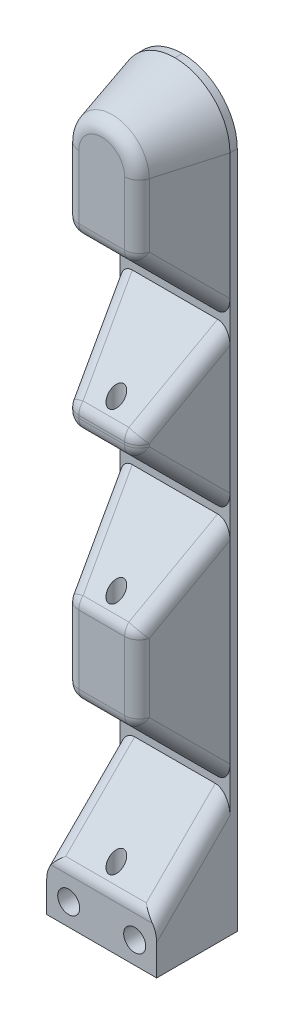
from build123d import *

# Parameters (mm, degrees)
SKETCH1_W                     = 15
SKETCH1_H                     = 100
BOSS_EXTRUDE1_DEPTH           = 1
FILLET1_R                     = 7.5
BOSS_EXTRUDE2_DEPTH           = 10
BOSS_EXTRUDE2_DRAFT           = 16
SKETCH3_W                     = 15
SKETCH3_H                     = 22
BOSS_EXTRUDE2_PROFILE_2_DEPTH = 10
BOSS_EXTRUDE2_PROFILE_2_DRAFT = 16
SKETCH3_H_2                   = 31
BOSS_EXTRUDE2_PROFILE_3_DEPTH = 10
BOSS_EXTRUDE2_PROFILE_3_DRAFT = 16
SKETCH3_3_W                   = 15
SKETCH3_3_H                   = 17
BOSS_EXTRUDE3_DEPTH           = 10
CUT_EXTRUDE1_DEPTH            = 102.71528892
SKETCH5_R                     = 1
CUT_EXTRUDE2_DEPTH            = 95
FILLET2_R                     = 2
SKETCH6_R                     = 1.5
CUT_EXTRUDE3_DEPTH            = 102.71528892


with BuildPart() as part:
    # Sketch1 → Boss-Extrude1 (new body)
    with BuildSketch(Plane.XY):
        with Locations((-7.5, 50)):
            Rectangle(SKETCH1_W, SKETCH1_H)
    extrude(amount=BOSS_EXTRUDE1_DEPTH)

    # Fillet1
    fillet1_edges = [part.edges().sort_by_distance(p)[0] for p in [
        (0, 100, 0.5),
        (-15, 100, 0.5),
    ]]
    fillet(fillet1_edges, radius=FILLET1_R - 0.0001)  # a hair under: the kernel refuses the full size


with BuildPart() as boss_extrude2_tool:
    # Sketch3 → Boss-Extrude2 (with draft: the straight prism first)
    with BuildSketch(Plane.XY.offset(1)):
        with BuildLine():
            ThreePointArc((-7.5, 100), (-12.803300859, 97.803300859), (-15, 92.5))
            Line((-15, 92.5), (-15, 73))
            Line((-15, 73), (0, 73))
            Line((0, 73), (0, 92.5))
            ThreePointArc((0, 92.5), (-2.196699141, 97.803300859), (-7.5, 100))
        make_face()
    extrude(amount=BOSS_EXTRUDE2_DEPTH)
    # Boss-Extrude2: the draft: its side faces are tilted about the plane it starts from
    boss_extrude2_sides = [boss_extrude2_tool.faces().sort_by_distance(p)[0] for p in [
        (-7.5, 100, 6),
        (-7.5, 73, 6),
        (0, 82.75, 6),
        (-15, 82.75, 6),
    ]]
    draft(boss_extrude2_sides, Plane.XY.offset(1), BOSS_EXTRUDE2_DRAFT)


with BuildPart() as part_1:
    add(part.part)

    # Boss-Extrude2: add boss_extrude2_tool
    add(boss_extrude2_tool.part)


with BuildPart() as boss_extrude2_profile_2_tool:
    # Sketch3 → Boss-Extrude2 profile 2 (with draft: the straight prism first)
    with BuildSketch(Plane.XY.offset(1)):
        with Locations((-7.5, 61)):
            Rectangle(SKETCH3_W, SKETCH3_H)
    extrude(amount=BOSS_EXTRUDE2_PROFILE_2_DEPTH)
    # Boss-Extrude2 profile 2: the draft: its side faces are tilted about the plane it starts from
    boss_extrude2_profile_2_sides = [boss_extrude2_profile_2_tool.faces().sort_by_distance(p)[0] for p in [
        (-7.5, 72, 6),
        (-15, 61, 6),
        (-7.5, 50, 6),
        (0, 61, 6),
    ]]
    draft(boss_extrude2_profile_2_sides, Plane.XY.offset(1), BOSS_EXTRUDE2_PROFILE_2_DRAFT)


with BuildPart() as part_2:
    add(part_1.part)

    # Boss-Extrude2 profile 2: add boss_extrude2_profile_2_tool
    add(boss_extrude2_profile_2_tool.part)


with BuildPart() as boss_extrude2_profile_3_tool:
    # Sketch3 → Boss-Extrude2 profile 3 (with draft: the straight prism first)
    with BuildSketch(Plane.XY.offset(1)):
        with Locations((-7.5, 33.5)):
            Rectangle(SKETCH3_W, SKETCH3_H_2)
    extrude(amount=BOSS_EXTRUDE2_PROFILE_3_DEPTH)
    # Boss-Extrude2 profile 3: the draft: its side faces are tilted about the plane it starts from
    boss_extrude2_profile_3_sides = [boss_extrude2_profile_3_tool.faces().sort_by_distance(p)[0] for p in [
        (-7.5, 18, 6),
        (0, 33.5, 6),
        (-7.5, 49, 6),
        (-15, 33.5, 6),
    ]]
    draft(boss_extrude2_profile_3_sides, Plane.XY.offset(1), BOSS_EXTRUDE2_PROFILE_3_DRAFT)


with BuildPart() as part_3:
    add(part_2.part)

    # Boss-Extrude2 profile 3: add boss_extrude2_profile_3_tool
    add(boss_extrude2_profile_3_tool.part)

    # Sketch3<3> → Boss-Extrude3 (add)
    with BuildSketch(Plane.XY.offset(1)):
        with Locations((-7.5, 8.5)):
            Rectangle(SKETCH3_3_W, SKETCH3_3_H)
    extrude(amount=BOSS_EXTRUDE3_DEPTH)

    # Sketch4 → Cut-Extrude1 (cut, through all)
    with BuildSketch(Plane(origin=(0, 0, 0), x_dir=(0, 0, -1), z_dir=(1, 0, 0))):
        Polygon((-14.618204018, 86.618204018), (-1, 73), (-1, 72), (-12, 61), (-1, 50), (-1, 49), (-14.71384308, 35.28615692), (-14.71384308, 31.71384308), (-1, 18), (-1, 17), (-14.311925723, 3.688074277), (-29.385419391, 3.688074277), (-29.385419391, 86.618204018), align=None)
    extrude(amount=-CUT_EXTRUDE1_DEPTH, mode=Mode.SUBTRACT)

    # Sketch5 → Cut-Extrude2 (cut)
    with BuildSketch(Plane.XZ):
        with Locations(Location((-7.5, 9, 0), (0, 0, 270))):
            Circle(SKETCH5_R)
    extrude(amount=-CUT_EXTRUDE2_DEPTH, mode=Mode.SUBTRACT)

    # Fillet2
    fillet2_edges = [part_3.edges().sort_by_distance(p)[0] for p in [
        (-15, 12, 6),
        (0, 12, 6),
        (-12.132546142, 87.75, 11),
        (-7.5, 97.132546142, 11),
        (-7.5, 7, 11),
        (-12.132546142, 33.5, 11),
        (-2.867453858, 33.5, 11),
        (-7.5, 28, 11),
        (-7.5, 39, 11),
        (-12.132546142, 61, 11),
        (-2.867453858, 61, 11),
        (-7.5, 60, 11),
        (-7.5, 62, 11),
        (-2.867453858, 87.75, 11),
        (-7.5, 83, 11),
        (-13.566273071, 78, 6),
        (-1.433726929, 78, 6),
        (-13.566273071, 67, 6),
        (-1.433726929, 67, 6),
        (-13.566273071, 55, 6),
        (-1.433726929, 55, 6),
        (-13.566273071, 44, 6),
        (-1.433726929, 44, 6),
        (-13.566273071, 23, 6),
        (-1.433726929, 23, 6),
    ]]
    fillet(fillet2_edges, radius=FILLET2_R)

    # Sketch6 → Cut-Extrude3 (cut, through all)
    with BuildSketch(Plane.XY.offset(11)):
        with Locations((-12, 3)):
            Circle(SKETCH6_R)
        with Locations((-3, 3)):
            Circle(SKETCH6_R)
    extrude(amount=-CUT_EXTRUDE3_DEPTH, mode=Mode.SUBTRACT)


solid = part_3.part
